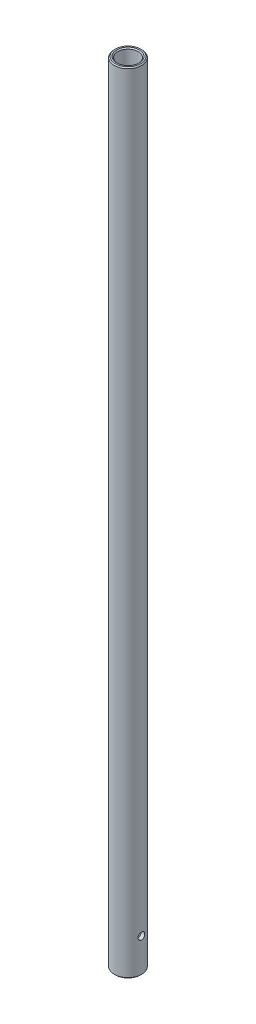
from build123d import *

# Parameters (mm, degrees)
SKETCH_1_R               = 4
SKETCH_1_R_2             = 3
EXTRUDE_1_DEPTH          = 230
CHAMFER_1_SIZE           = 0.3
CUT_EXTRUDE_1_DEPTH      = 231.0695547
CUT_EXTRUDE_1_DEPTH_BACK = 231.0695547
SKETCH_2_R               = 1


with BuildPart() as part:
    # Эскиз1 → Бобышка-Вытянуть1 (new body)
    with BuildSketch(Plane(origin=(0, 0, 0), x_dir=(1, 0, 0), z_dir=(0, 1, 0))):
        Circle(SKETCH_1_R)
        Circle(SKETCH_1_R_2, mode=Mode.SUBTRACT)
    extrude(amount=EXTRUDE_1_DEPTH)

    # Фаска1
    chamfer_1_edges = [part.edges().sort_by_distance(p)[0] for p in [
        (-3, 230, 0),
        (-3, 0, 0),
        (-4, 0, 0),
        (-4, 230, 0),
    ]]
    chamfer(chamfer_1_edges, length=CHAMFER_1_SIZE)

    # Эскиз2 → Вырез-Вытянуть1 (cut, two sides: drawn at the far end of the back side and taken through both)
    with BuildSketch(Plane(origin=(0, 0, 0), x_dir=(0, 0, -1), z_dir=(1, 0, 0)).offset(-CUT_EXTRUDE_1_DEPTH_BACK)):
        with Locations((0, 10)):
            Circle(SKETCH_2_R)
    extrude(amount=CUT_EXTRUDE_1_DEPTH + CUT_EXTRUDE_1_DEPTH_BACK, mode=Mode.SUBTRACT)


solid = part.part
